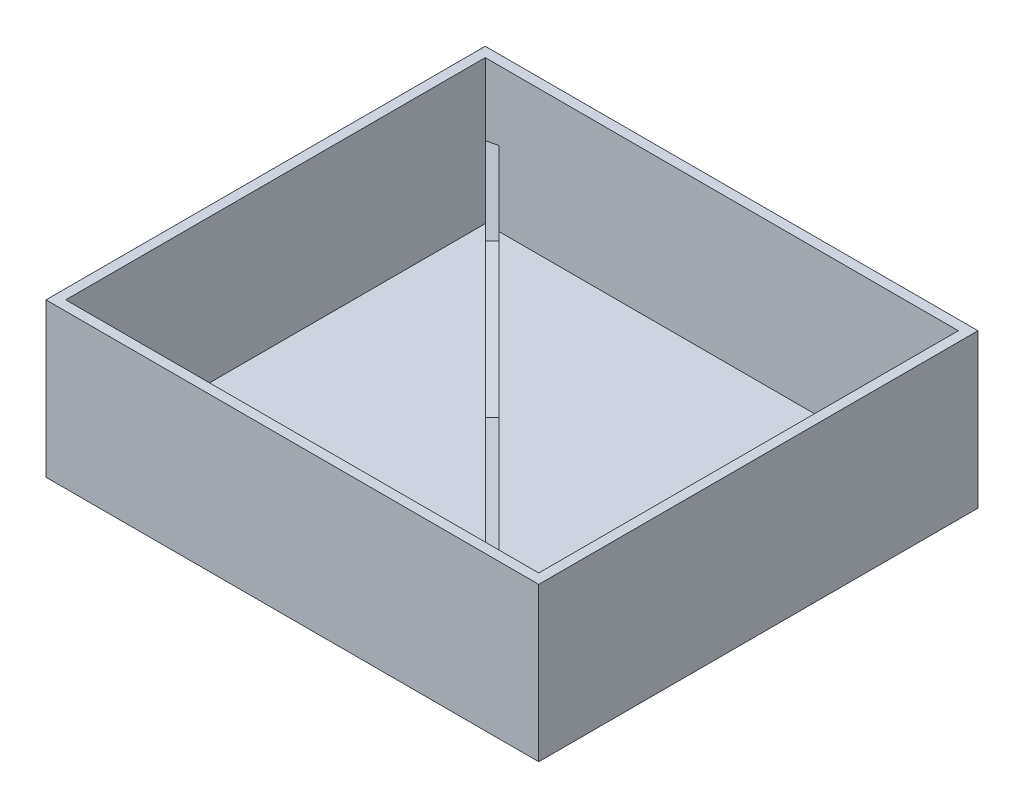
from build123d import *

# Parameters (mm, degrees)
SKETCH1_W                  = 127.078191072
SKETCH1_H                  = 113.282646321
BOSS_EXTRUDE1_DEPTH        = 39.624
SHELL_1_T                  = -2.54
OFFICIAL_RIB_BLOCK20_START = -2.54
OFFICIAL_RIB_BLOCK20_DEPTH = 2.54


with BuildPart() as part:
    # Sketch1 → Boss-Extrude1 (new body)
    with BuildSketch(Plane(origin=(0, 0, 0), x_dir=(1, 0, 0), z_dir=(0, 1, 0))):
        with Locations((1.06119575, 7.295720781)):
            Rectangle(SKETCH1_W, SKETCH1_H)
    extrude(amount=BOSS_EXTRUDE1_DEPTH)

    # 抽壳1
    shell_1_openings = [part.faces().sort_by_distance(p)[0] for p in [
        (1.06119575, 39.624, -7.295720782),
    ]]
    offset(amount=SHELL_1_T, openings=shell_1_openings, kind=Kind.INTERSECTION)

    # official_rib_block20: read off the stored shape, not the designer's step
    # official_rib_block20 outline → official_rib_block20 (add)
    with BuildSketch(Plane(origin=(0.729572078, 0, -0.729572078), x_dir=(0.7071067811865477, 0, 0.7071067811865475), z_dir=(-0.7071067811865475, 0, 0.7071067811865477)).offset(OFFICIAL_RIB_BLOCK20_START)):
        Polygon((-85.796761505, 21.08206499), (-85.796761505, 2.54), (69.764888407, 2.54), (69.764888407, 33.885045833), (7.726, 25.357), (-34.23, 35.134), align=None)
    extrude(amount=OFFICIAL_RIB_BLOCK20_DEPTH)


solid = part.part
